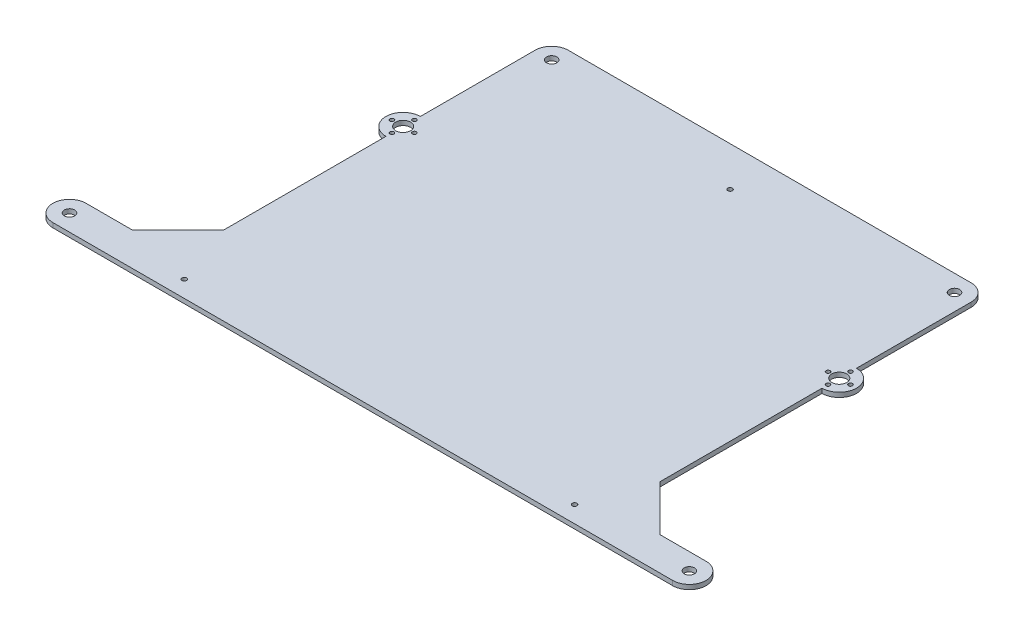
from build123d import *

# Parameters (mm, degrees)
SKETCH1_R           = 4.5
SKETCH1_R_2         = 6.5
SKETCH1_R_3         = 1.75
BOSS_EXTRUDE1_DEPTH = 4
SKETCH2_R           = 2
CUT_EXTRUDE1_DEPTH  = 4
SKETCH3_R           = 2
CUT_EXTRUDE2_DEPTH  = 10


with BuildPart() as part:
    # Sketch1 → Boss-Extrude1 (new body)
    with BuildSketch(Plane(origin=(0, 0, 0), x_dir=(1, 0, 0), z_dir=(0, 1, 0))):
        with BuildLine():
            Line((-270, -14.5), (0, -14.5))
            Line((0, -14.5), (0, 340))
            Line((0, 340), (-175.463800793, 340))
            ThreePointArc((-175.463800793, 340), (-185.71684912, 335.753048327), (-189.963800793, 325.5))
            Line((-189.963800793, 325.5), (-189.963800793, 225.606590828))
            ThreePointArc((-189.963800793, 225.606590828), (-204.963800793, 210.606590828), (-189.963800793, 195.606590828))
            Line((-189.963800793, 195.606590828), (-189.963800793, 54.5))
            Line((-189.963800793, 54.5), (-229.963800793, 14.5))
            Line((-229.963800793, 14.5), (-270, 14.5))
            ThreePointArc((-270, 14.5), (-284.5, 0), (-270, -14.5))
        make_face()
        with Locations((-270, 0)):
            Circle(SKETCH1_R, mode=Mode.SUBTRACT)
        with Locations((-175.463800793, 325.5)):
            Circle(SKETCH1_R, mode=Mode.SUBTRACT)
        with Locations((-189.963800793, 210.606590828)):
            Circle(SKETCH1_R_2, mode=Mode.SUBTRACT)
        with Locations((-180.213800793, 210.606590828)):
            Circle(SKETCH1_R_3, mode=Mode.SUBTRACT)
        with Locations((-189.963800793, 220.406590828)):
            Circle(SKETCH1_R_3, mode=Mode.SUBTRACT)
        with Locations((-189.963800793, 200.806590828)):
            Circle(SKETCH1_R_3, mode=Mode.SUBTRACT)
        with Locations((-199.713800793, 210.606590828)):
            Circle(SKETCH1_R_3, mode=Mode.SUBTRACT)
    boss_extrude1 = extrude(amount=BOSS_EXTRUDE1_DEPTH)

    # Mirror1: Boss-Extrude1 across plane
    add(boss_extrude1.mirror(Plane(origin=(0, 4, -340), x_dir=(0, 0, 1), z_dir=(-1, 0, 0))))

    # Sketch2 → Cut-Extrude1 (cut)
    with BuildSketch(Plane(origin=(0, 4, 0), x_dir=(1, 0, 0), z_dir=(0, 1, 0))):
        with Locations((0, 305.5)):
            Circle(SKETCH2_R)
    extrude(amount=-CUT_EXTRUDE1_DEPTH, mode=Mode.SUBTRACT)

    # Sketch3 → Cut-Extrude2 (cut)
    with BuildSketch(Plane(origin=(0, 4, 0), x_dir=(1, 0, 0), z_dir=(0, 1, 0))):
        with Locations((-170, 0)):
            Circle(SKETCH3_R)
        with Locations((170, 0)):
            Circle(SKETCH3_R)
    extrude(amount=-CUT_EXTRUDE2_DEPTH, mode=Mode.SUBTRACT)


solid = part.part
